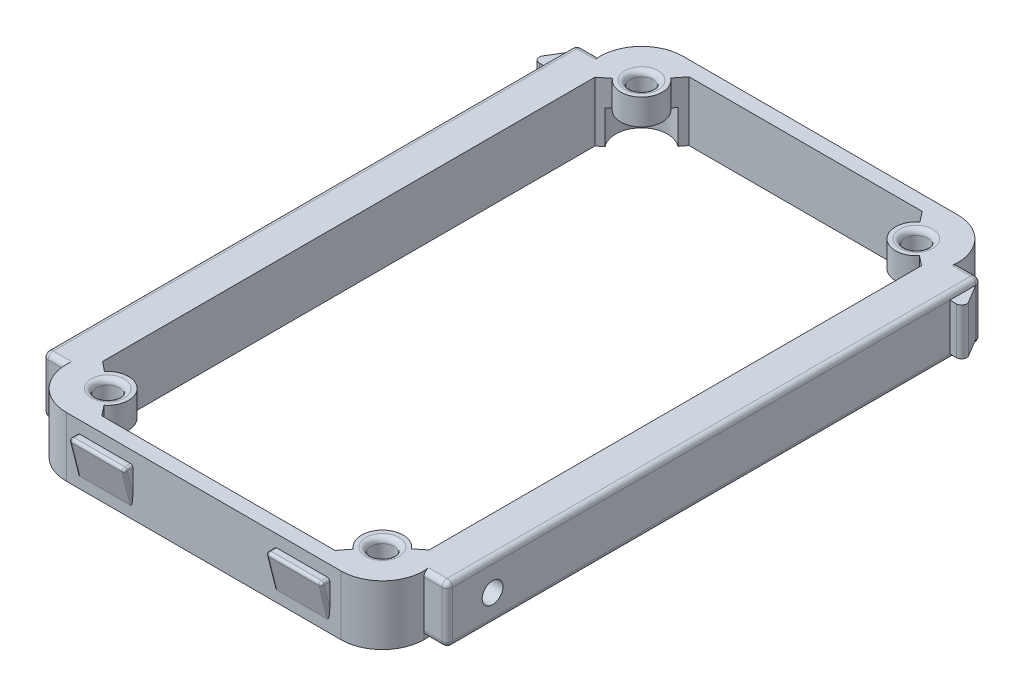
from build123d import *

# Parameters (mm, degrees)
SKETCH1_W            = 65
SKETCH1_H            = 115
SKETCH1_W_2          = 55
SKETCH1_H_2          = 105
BOSS_EXTRUDE1_DEPTH  = 23
FILLET1_R            = 6
SKETCH2_R            = 6
BOSS_EXTRUDE2_DEPTH  = 23
SKETCH4_R            = 2.2
CUT_EXTRUDE1_DEPTH   = 23
SKETCH7_W            = 55
SKETCH7_H            = 105
CUT_EXTRUDE2_DEPTH   = 13
SKETCH8_W            = 65
SKETCH8_H            = 11.5
CUT_EXTRUDE3_DEPTH   = 120
SKETCH9_R            = 5
CUT_EXTRUDE4_DEPTH   = 6.5
BOSS_EXTRUDE3_DEPTH  = 11.5
SKETCH13_W           = 10.707106782
SKETCH13_H           = 7
BOSS_EXTRUDE5_DEPTH  = 1.75
CUT_EXTRUDE5_REACH   = 90.002
FILLET3_R            = 0.5
FILLET3_OF_MIRROR4_R = 0.5
FILLET5_R            = 1
CUT_EXTRUDE7_DEPTH   = 72.111775792
SKETCH18_W           = 4.5
SKETCH18_H           = 103
BOSS_EXTRUDE6_DEPTH  = 11
FILLET6_R            = 1
SKETCH20_W           = 5
SKETCH20_H           = 9
BOSS_EXTRUDE7_DEPTH  = 3
SKETCH21_W           = 5
SKETCH21_H           = 9
BOSS_EXTRUDE8_DEPTH  = 3
CUT_EXTRUDE8_DEPTH   = 24
FILLET7_R            = 1
SKETCH23_R           = 2
CUT_EXTRUDE9_DEPTH   = 8


# Some blends are built 0.0001 mm under size
with BuildPart() as part:
    # Sketch1 → Boss-Extrude1 (new body)
    with BuildSketch(Plane(origin=(0, 0, 0), x_dir=(1, 0, 0), z_dir=(0, 1, 0))):
        Rectangle(SKETCH1_W, SKETCH1_H)
        Rectangle(SKETCH1_W_2, SKETCH1_H_2, mode=Mode.SUBTRACT)
    extrude(amount=BOSS_EXTRUDE1_DEPTH)

    # Fillet1
    fillet1_edges = [part.edges().sort_by_distance(p)[0] for p in [
        (32.5, 11.5, 57.5),
        (-32.5, 11.5, 57.5),
        (-32.5, 11.5, -57.5),
        (32.5, 11.5, -57.5),
    ]]
    fillet(fillet1_edges, radius=FILLET1_R)

    # Sketch2 → Boss-Extrude2 (add)
    with BuildSketch(Plane(origin=(0, 23, 0), x_dir=(1, 0, 0), z_dir=(0, 1, 0))):
        with Locations((-26.5, 51.5)):
            Circle(SKETCH2_R)
        with Locations((26.5, 51.5)):
            Circle(SKETCH2_R)
        with Locations((-26.5, -51.5)):
            Circle(SKETCH2_R)
        with Locations((26.5, -51.5)):
            Circle(SKETCH2_R)
    extrude(amount=-BOSS_EXTRUDE2_DEPTH)

    # Sketch4 → Cut-Extrude1 (cut)
    with BuildSketch(Plane(origin=(0, 23, 0), x_dir=(1, 0, 0), z_dir=(0, 1, 0))):
        with Locations(Location((-26.5, 51.5, 0), (0, 0, 270))):
            Circle(SKETCH4_R)
        with Locations(Location((26.5, 51.5, 0), (0, 0, 270))):
            Circle(SKETCH4_R)
        with Locations(Location((26.5, -51.5, 0), (0, 0, 270))):
            Circle(SKETCH4_R)
        with Locations(Location((-26.5, -51.5, 0), (0, 0, 270))):
            Circle(SKETCH4_R)
    extrude(amount=-CUT_EXTRUDE1_DEPTH, mode=Mode.SUBTRACT)

    # Sketch7 → Cut-Extrude2 (cut)
    with BuildSketch(Plane(origin=(0, 18, 0), x_dir=(1, 0, 0), z_dir=(0, 1, 0))):
        Rectangle(SKETCH7_W, SKETCH7_H)
    extrude(amount=-CUT_EXTRUDE2_DEPTH, mode=Mode.SUBTRACT)

    # Sketch8 → Cut-Extrude3 (cut)
    with BuildSketch(Plane.XY.offset(57.5)):
        with Locations((0, 5.75)):
            Rectangle(SKETCH8_W, SKETCH8_H)
    extrude(amount=-CUT_EXTRUDE3_DEPTH, mode=Mode.SUBTRACT)

    # Sketch9 → Cut-Extrude4 (cut)
    with BuildSketch(Plane.XZ.offset(-18)):
        with Locations((-26.5, -51.5)):
            Circle(SKETCH9_R)
        with Locations((26.5, -51.5)):
            Circle(SKETCH9_R)
        with Locations((26.5, 51.5)):
            Circle(SKETCH9_R)
        with Locations((-26.5, 51.5)):
            Circle(SKETCH9_R)
    extrude(amount=CUT_EXTRUDE4_DEPTH, mode=Mode.SUBTRACT)

    # Sketch10 → Boss-Extrude3 (add)
    with BuildSketch(Plane(origin=(0, 23, 0), x_dir=(1, 0, 0), z_dir=(0, 1, 0))):
        with BuildLine():
            Line((-26.5, -59.5), (26.5, -59.5))
            ThreePointArc((26.5, -59.5), (32.156854249, -57.156854249), (34.5, -51.5))
            Line((34.5, -51.5), (34.5, 51.5))
            ThreePointArc((34.5, 51.5), (32.156854249, 57.156854249), (26.5, 59.5))
            Line((26.5, 59.5), (-26.5, 59.5))
            ThreePointArc((-26.5, 59.5), (-32.156854249, 57.156854249), (-34.5, 51.5))
            Line((-34.5, 51.5), (-34.5, -51.5))
            ThreePointArc((-34.5, -51.5), (-32.156854249, -57.156854249), (-26.5, -59.5))
        make_face()
        with BuildLine():
            Line((-26.5, -57.5), (26.5, -57.5))
            ThreePointArc((26.5, -57.5), (30.742640687, -55.742640687), (32.5, -51.5))
            Line((32.5, -51.5), (32.5, 51.5))
            ThreePointArc((32.5, 51.5), (30.742640687, 55.742640687), (26.5, 57.5))
            Line((26.5, 57.5), (-26.5, 57.5))
            ThreePointArc((-26.5, 57.5), (-30.742640687, 55.742640687), (-32.5, 51.5))
            Line((-32.5, 51.5), (-32.5, -51.5))
            ThreePointArc((-32.5, -51.5), (-30.742640687, -55.742640687), (-26.5, -57.5))
        make_face(mode=Mode.SUBTRACT)
    extrude(amount=-BOSS_EXTRUDE3_DEPTH)

    # Sketch13 → Boss-Extrude5 (add)
    with BuildSketch(Plane(origin=(0, 0, -59.5), x_dir=(-1, 0, 0), z_dir=(0, 0, -1))):
        with Locations((19, 17.146446609)):
            Rectangle(SKETCH13_W, SKETCH13_H)
        with Locations((-19, 17.146446609)):
            Rectangle(SKETCH13_W, SKETCH13_H)
    boss_extrude5 = extrude(amount=BOSS_EXTRUDE5_DEPTH)

    # Cut-Extrude5: up to this face of the body (flat: up to its plane)
    cut_extrude5_end = Plane(part.part.faces().sort_by_distance((24.353553391, 17.146446609, -60.375))[0])
    # Sketch14 → Cut-Extrude5 (cut, up to the picked face)
    with BuildSketch(Plane.ZY.offset(24.353553391), mode=Mode.PRIVATE) as cut_extrude5_sk1:
        Polygon((-59.5, 13.646446609), (-61.25, 13.646446609), (-61.25, 20.646446609), align=None)
    cut_extrude5_tool1 = split(extrude(cut_extrude5_sk1.sketch, amount=-CUT_EXTRUDE5_REACH, mode=Mode.PRIVATE), bisect_by=cut_extrude5_end, keep=Keep.BOTH, mode=Mode.PRIVATE)
    cut_extrude5 = cut_extrude5_tool1.solids().sort_by(Axis((-24.353553, 15.97978, -60.666667), (1, 0, 0)))[0]
    add(cut_extrude5, mode=Mode.SUBTRACT)

    # Fillet3
    fillet3_edges = [part.edges().sort_by_distance(p)[0] for p in [
        (-24.353553391, 20.646446609, -60.375),
        (-13.646446609, 20.646446609, -60.375),
        (-19, 20.646446609, -61.25),
        (13.646446609, 20.646446609, -60.375),
        (24.353553391, 20.646446609, -60.375),
        (19, 20.646446609, -61.25),
        (13.646446609, 17.146446609, -60.375),
        (-13.646446609, 17.146446609, -60.375),
        (-24.353553391, 17.146446609, -60.375),
        (24.353553391, 17.146446609, -60.375),
    ]]
    fillet(fillet3_edges, radius=FILLET3_R)

    # Mirror4: Boss-Extrude5, Cut-Extrude5 across plane
    add(boss_extrude5.mirror(Plane.XY))
    add(cut_extrude5.mirror(Plane.XY), mode=Mode.SUBTRACT)

    # Fillet3 of Mirror4
    fillet3_of_mirror4_edges = [part.edges().sort_by_distance(p)[0] for p in [
        (-24.353553391, 20.646446609, 60.375),
        (-13.646446609, 20.646446609, 60.375),
        (-19, 20.646446609, 61.25),
        (13.646446609, 20.646446609, 60.375),
        (24.353553391, 20.646446609, 60.375),
        (19, 20.646446609, 61.25),
        (13.646446609, 17.146446609, 60.375),
        (-13.646446609, 17.146446609, 60.375),
        (-24.353553391, 17.146446609, 60.375),
        (24.353553391, 17.146446609, 60.375),
    ]]
    fillet(fillet3_of_mirror4_edges, radius=FILLET3_OF_MIRROR4_R)

    # Fillet5
    fillet5_edges = [part.edges().sort_by_distance(p)[0] for p in [
        (-26.5, 23, 49.3),
        (26.5, 23, 49.3),
        (26.5, 23, -53.7),
        (-26.5, 23, -53.7),
        (-26.5, 18, 49.3),
        (27.5, 20.5, -45.583920217),
        (-20.583920217, 20.5, -52.5),
        (-27.5, 20.5, 45.583920217),
        (20.583920217, 20.5, 52.5),
        (22.257359313, 18, 47.257359313),
        (22.257359313, 18, -47.257359313),
        (-22.257359313, 18, -47.257359313),
        (-22.257359313, 18, 47.257359313),
        (21.092470366, 18, 52.5),
        (26.5, 18, 49.3),
        (-27.5, 18, 46.092470366),
        (-21.092470366, 18, -52.5),
        (-26.5, 18, -53.7),
        (27.5, 18, -46.092470366),
        (26.5, 18, -53.7),
        (-27.5, 18, -46.092470366),
        (21.092470366, 18, -52.5),
        (27.5, 18, 46.092470366),
        (-21.092470366, 18, 52.5),
        (-20.583920217, 20.5, 52.5),
        (-27.5, 20.5, -45.583920217),
        (20.583920217, 20.5, -52.5),
        (27.5, 20.5, 45.583920217),
    ]]
    fillet(fillet5_edges, radius=FILLET5_R - 0.0001)  # a hair under: the kernel refuses the full size

    # Sketch16 → Cut-Extrude7 (cut, through all)
    with BuildSketch(Plane.XZ.offset(-11.5)):
        with BuildLine():
            Line((22.5, -56.652006057), (-22.5, -56.652006057))
            Line((-22.5, -56.652006057), (-24.046957473, -54.659522489))
            ThreePointArc((-24.046957473, -54.659522489), (-23.651058564, -48.692237066), (-29.623475238, -49.00121981))
            Line((-29.623475238, -49.00121981), (-31.5, -47.5))
            Line((-31.5, -47.5), (-31.5, 47.5))
            Line((-31.5, 47.5), (-29.623475238, 49.00121981))
            ThreePointArc((-29.623475238, 49.00121981), (-23.651058564, 48.692237066), (-24.046957473, 54.659522489))
            Line((-24.046957473, 54.659522489), (-22.5, 56.652006057))
            Line((-22.5, 56.652006057), (22.5, 56.652006057))
            Line((22.5, 56.652006057), (24.046957473, 54.659522489))
            ThreePointArc((24.046957473, 54.659522489), (23.651058564, 48.692237066), (29.623475238, 49.00121981))
            Line((29.623475238, 49.00121981), (31.5, 47.5))
            Line((31.5, 47.5), (31.5, -47.5))
            Line((31.5, -47.5), (29.623475238, -49.00121981))
            ThreePointArc((29.623475238, -49.00121981), (23.651058564, -48.692237066), (24.046957473, -54.659522489))
            Line((24.046957473, -54.659522489), (22.5, -56.652006057))
        make_face()
    extrude(amount=-CUT_EXTRUDE7_DEPTH, mode=Mode.SUBTRACT)

    # Sketch18 → Boss-Extrude6 (add)
    with BuildSketch(Plane(origin=(0, 23, 0), x_dir=(1, 0, 0), z_dir=(0, 1, 0))):
        with Locations((-36.75, 0)):
            Rectangle(SKETCH18_W, SKETCH18_H)
        with Locations((36.75, 0)):
            Rectangle(SKETCH18_W, SKETCH18_H)
    extrude(amount=-BOSS_EXTRUDE6_DEPTH)

    # Fillet6
    fillet6_edges = [part.edges().sort_by_distance(p)[0] for p in [
        (-36.75, 12, 51.5),
        (-39, 12, 0),
        (-39, 17.5, 51.5),
        (-36.75, 12, -51.5),
        (-39, 17.5, -51.5),
        (-36.75, 23, -51.5),
        (-39, 23, 0),
        (-36.75, 23, 51.5),
        (36.75, 12, -51.5),
        (39, 12, 0),
        (39, 17.5, -51.5),
        (36.75, 12, 51.5),
        (39, 17.5, 51.5),
        (36.75, 23, 51.5),
        (39, 23, 0),
        (36.75, 23, -51.5),
    ]]
    fillet(fillet6_edges, radius=FILLET6_R)

    # Sketch20 → Boss-Extrude7 (add)
    with BuildSketch(Plane(origin=(39, 0, 0), x_dir=(0, 0, -1), z_dir=(1, 0, 0))):
        with Locations((48, 17.5)):
            Rectangle(SKETCH20_W, SKETCH20_H)
    extrude(amount=BOSS_EXTRUDE7_DEPTH)

    # Sketch21 → Boss-Extrude8 (add)
    with BuildSketch(Plane.ZY.offset(39)):
        with Locations((-48, 17.5)):
            Rectangle(SKETCH21_W, SKETCH21_H)
    extrude(amount=BOSS_EXTRUDE8_DEPTH)

    # Sketch22 → Cut-Extrude8 (cut)
    with BuildSketch(Plane(origin=(0, 22, 0), x_dir=(1, 0, 0), z_dir=(0, 1, 0))):
        Polygon((42, 45.5), (42, 50.5), (39, 50.5), align=None)
        Polygon((-39, 50.5), (-42, 50.5), (-42, 45.5), align=None)
    extrude(amount=-CUT_EXTRUDE8_DEPTH, mode=Mode.SUBTRACT)

    # Fillet7
    # the kernel refuses this fillet: 1 mm, written as the material it adds along each edge
    with BuildSketch(Plane(origin=(-39, 22, -50.5), x_dir=(0.08023374976130676, 0, -0.9967760758561774), z_dir=(0, -1, 0))) as fillet7_piece_1:
        with BuildLine():
            CenterArc((0.240701249, -0.996776076), FILLET7_R, 94.602001801, 21.75975293)
            Line((-0.203335938, -0.100767719), (0, 0))
            ThreePointArc((0, 0), (0.08023375, -0.003223924), (0.1604675, 0))
        make_face()
    extrude(amount=9)
    with BuildSketch(Plane(origin=(39, 22, -50.5), x_dir=(-0.08023374976133658, 0, -0.996776075856175), z_dir=(0, -1, 0))) as fillet7_piece_2:
        with BuildLine():
            CenterArc((0.240701249, 0.996776076), FILLET7_R, 243.638245269, 21.75975293)
            Line((-0.203335938, 0.100767719), (0, 0))
            ThreePointArc((0, 0), (0.08023375, 0.003223924), (0.1604675, 0))
        make_face()
    extrude(amount=9)
    # the kernel refuses this fillet: 1 mm, written as the material it takes off along each edge
    with BuildSketch(Plane(origin=(42, 26.415475947, -45.5), x_dir=(-1, 0, 0), z_dir=(0, -1, 0))) as fillet7_2_piece_1:
        with BuildLine():
            CenterArc((FILLET7_R * 1.76619037897, FILLET7_R), FILLET7_R, 149.036243468, 120.963756532)
            Line((FILLET7_R * 0.908697453257, FILLET7_R * 1.51449575543), (0, 0))
            Line((0, 0), (FILLET7_R * 1.76619037897, 0))
        make_face()
    extrude(amount=17.830951895, mode=Mode.SUBTRACT)
    with BuildSketch(Plane(origin=(-42, 26.415475947, -45.5), x_dir=(1, 0, 0), z_dir=(0, -1, 0))) as fillet7_2_piece_2:
        with BuildLine():
            CenterArc((FILLET7_R * 1.76619037897, -FILLET7_R), FILLET7_R, 90, 120.963756532)
            Line((FILLET7_R * 0.908697453257, -FILLET7_R * 1.51449575543), (0, 0))
            Line((0, 0), (FILLET7_R * 1.76619037897, 0))
        make_face()
    extrude(amount=17.830951895, mode=Mode.SUBTRACT)

    # Sketch23 → Cut-Extrude9 (cut)
    with BuildSketch(Plane(origin=(39, 0, 0), x_dir=(0, 0, -1), z_dir=(1, 0, 0))):
        with Locations((-42.75, 17.25)):
            Circle(SKETCH23_R)
    extrude(amount=-CUT_EXTRUDE9_DEPTH, mode=Mode.SUBTRACT)


solid = part.part
